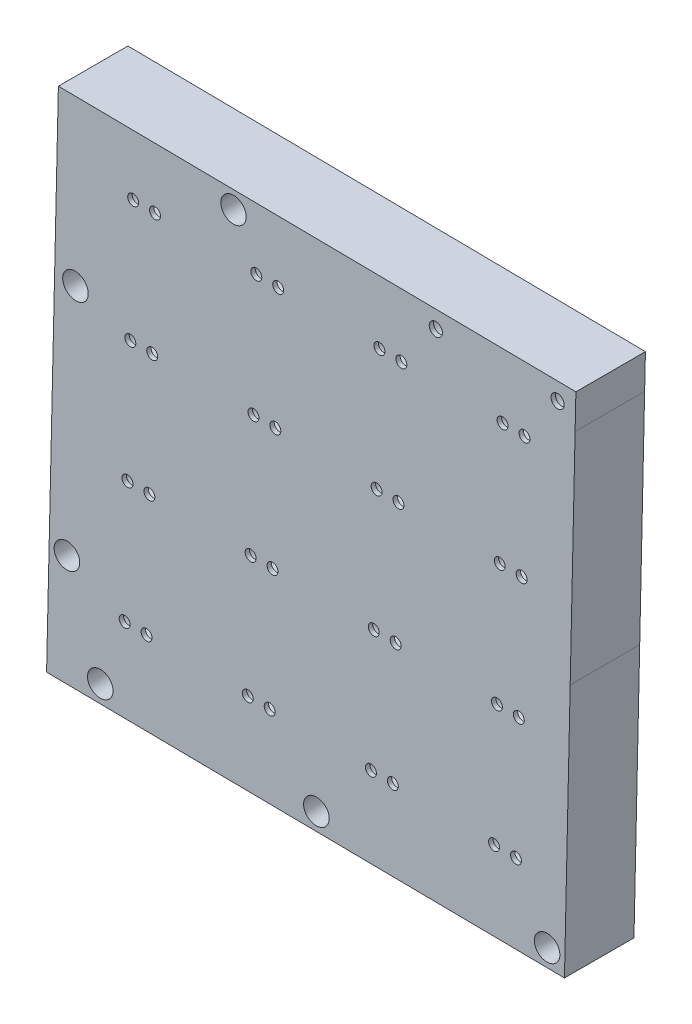
from build123d import *

# Parameters (mm, degrees)
SKETCH1_R           = 2
BOSS_EXTRUDE1_DEPTH = 1.5875
SKETCH5_R           = 5.08
SKETCH5_RX          = 4.682540056
SKETCH5_RY          = 4.572
SKETCH5_RX_2        = 4.738927588
SKETCH5_RX_3        = 4.634785374
BOSS_EXTRUDE2_DEPTH = 23.8125


with BuildPart() as part:
    # Sketch1 → Boss-Extrude1 (new body)
    with BuildSketch(Plane.XY):
        Polygon((99.117580399, -231.854490496), (99.409870771, -219.138709881), (-89.659246963, -216.965985044), (-93.970529946, -404.523749128), (95.228462617, -406.697966446), (97.319166692, -312.918338233), align=None)
        with BuildLine():
            add(Edge.make_bspline(
                [(-78.898400785, -399.474150819), (-77.064470838, -407.177802742), (-71.148575176, -401.699347247), (-65.232679515, -396.220891751), (-72.982505123, -393.995695323), (-80.732330731, -391.770498896), (-78.898400785, -399.474150819)],
                knots=[0, 0, 0, 2.094395102, 2.094395102, 4.188790205, 4.188790205, 6.283185307, 6.283185307, 6.283185307], degree=2, weights=[1, 0.5, 1, 0.5, 1, 0.5, 1]))
        make_face(mode=Mode.SUBTRACT)
        with BuildLine():
            add(Edge.make_bspline(
                [(-91.096699713, -364.99229495), (-89.262769767, -372.695946873), (-83.346874105, -367.217491377), (-77.430978443, -361.739035882), (-85.180804052, -359.513839454), (-92.93062966, -357.288643027), (-91.096699713, -364.99229495)],
                knots=[0, 0, 0, 2.094395102, 2.094395102, 4.188790205, 4.188790205, 6.283185307, 6.283185307, 6.283185307], degree=2, weights=[1, 0.5, 1, 0.5, 1, 0.5, 1]))
        make_face(mode=Mode.SUBTRACT)
        with Locations((-65.443590373, -374.262170426)):
            Circle(SKETCH1_R, mode=Mode.SUBTRACT)
        with Locations((-57.44570304, -374.446013285)):
            Circle(SKETCH1_R, mode=Mode.SUBTRACT)
        with Locations((-20.455474121, -375.296286508)):
            Circle(SKETCH1_R, mode=Mode.SUBTRACT)
        with Locations((-12.457586787, -375.480129366)):
            Circle(SKETCH1_R, mode=Mode.SUBTRACT)
        with Locations((-64.409474292, -329.274054174)):
            Circle(SKETCH1_R, mode=Mode.SUBTRACT)
        with Locations((-56.411586958, -329.457897033)):
            Circle(SKETCH1_R, mode=Mode.SUBTRACT)
        with Locations((-19.42135804, -330.308170255)):
            Circle(SKETCH1_R, mode=Mode.SUBTRACT)
        with Locations((-11.423470706, -330.492013114)):
            Circle(SKETCH1_R, mode=Mode.SUBTRACT)
        with BuildLine():
            add(Edge.make_bspline(
                [(0.051178563, -400.381415389), (1.885108509, -408.085067312), (7.801004171, -402.606611817), (13.716899833, -397.128156321), (5.967074225, -394.902959894), (-1.782751383, -392.677763466), (0.051178563, -400.381415389)],
                knots=[0, 0, 0, 2.094395102, 2.094395102, 4.188790205, 4.188790205, 6.283185307, 6.283185307, 6.283185307], degree=2, weights=[1, 0.5, 1, 0.5, 1, 0.5, 1]))
        make_face(mode=Mode.SUBTRACT)
        with Locations((24.532642131, -376.330402589)):
            Circle(SKETCH1_R, mode=Mode.SUBTRACT)
        with Locations((32.530529465, -376.514245448)):
            Circle(SKETCH1_R, mode=Mode.SUBTRACT)
        with BuildLine():
            add(Edge.make_bspline(
                [(84.325625913, -401.349871724), (86.159555859, -409.053523647), (92.075451521, -403.575068152), (97.991347183, -398.096612656), (90.241521575, -395.871416229), (82.491695967, -393.646219801), (84.325625913, -401.349871724)],
                knots=[0, 0, 0, 2.094395102, 2.094395102, 4.188790205, 4.188790205, 6.283185307, 6.283185307, 6.283185307], degree=2, weights=[1, 0.5, 1, 0.5, 1, 0.5, 1]))
        make_face(mode=Mode.SUBTRACT)
        with Locations((69.520758384, -377.36451867)):
            Circle(SKETCH1_R, mode=Mode.SUBTRACT)
        with Locations((77.518645717, -377.548361529)):
            Circle(SKETCH1_R, mode=Mode.SUBTRACT)
        with Locations((25.566758213, -331.342286337)):
            Circle(SKETCH1_R, mode=Mode.SUBTRACT)
        with Locations((33.564645546, -331.526129196)):
            Circle(SKETCH1_R, mode=Mode.SUBTRACT)
        with Locations((70.554874465, -332.376402418)):
            Circle(SKETCH1_R, mode=Mode.SUBTRACT)
        with Locations((78.552761799, -332.560245277)):
            Circle(SKETCH1_R, mode=Mode.SUBTRACT)
        with BuildLine():
            add(Edge.make_bspline(
                [(-87.072855874, -274.025140099), (-92.123024506, -280.12475884), (-84.122649609, -281.608206697), (-76.122274712, -283.091654554), (-79.072480977, -275.508587956), (-82.022687241, -267.925521358), (-87.072855874, -274.025140099)],
                knots=[0, 0, 0, 2.094395102, 2.094395102, 4.188790205, 4.188790205, 6.283185307, 6.283185307, 6.283185307], degree=2, weights=[1, 0.5, 1, 0.5, 1, 0.5, 1]))
        make_face(mode=Mode.SUBTRACT)
        with Locations((-63.375358211, -284.285937922)):
            Circle(SKETCH1_R, mode=Mode.SUBTRACT)
        with Locations((-55.377470877, -284.46978078)):
            Circle(SKETCH1_R, mode=Mode.SUBTRACT)
        with Locations((-18.387241958, -285.320054003)):
            Circle(SKETCH1_R, mode=Mode.SUBTRACT)
        with Locations((-10.389354624, -285.503896862)):
            Circle(SKETCH1_R, mode=Mode.SUBTRACT)
        with Locations((-62.341242129, -239.297821669)):
            Circle(SKETCH1_R, mode=Mode.SUBTRACT)
        with Locations((-54.343354795, -239.481664528)):
            Circle(SKETCH1_R, mode=Mode.SUBTRACT)
        with BuildLine():
            add(Edge.make_bspline(
                [(-30.075944864, -225.507102008), (-27.604931247, -233.030641315), (-22.235386192, -227.099523908), (-16.865841137, -221.1684065), (-24.706399809, -219.575984601), (-32.546958482, -217.983562701), (-30.075944864, -225.507102008)],
                knots=[0, 0, 0, 2.094395102, 2.094395102, 4.188790205, 4.188790205, 6.283185307, 6.283185307, 6.283185307], degree=2, weights=[1, 0.5, 1, 0.5, 1, 0.5, 1]))
        make_face(mode=Mode.SUBTRACT)
        with Locations((-17.353125877, -240.331937751)):
            Circle(SKETCH1_R, mode=Mode.SUBTRACT)
        with Locations((-9.355238543, -240.51578061)):
            Circle(SKETCH1_R, mode=Mode.SUBTRACT)
        with Locations((26.600874294, -286.354170084)):
            Circle(SKETCH1_R, mode=Mode.SUBTRACT)
        with Locations((34.598761628, -286.538012943)):
            Circle(SKETCH1_R, mode=Mode.SUBTRACT)
        with Locations((71.588990546, -287.388286166)):
            Circle(SKETCH1_R, mode=Mode.SUBTRACT)
        with Locations((79.58687788, -287.572129025)):
            Circle(SKETCH1_R, mode=Mode.SUBTRACT)
        with Locations((27.634990375, -241.366053832)):
            Circle(SKETCH1_R, mode=Mode.SUBTRACT)
        with Locations((35.632877709, -241.549896691)):
            Circle(SKETCH1_R, mode=Mode.SUBTRACT)
        with BuildLine():
            add(Edge.make_bspline(
                [(49.746771765, -226.803003688), (53.017264097, -224.200776392), (49.123023453, -222.662774438), (45.228782809, -221.124772483), (45.852531121, -225.265001734), (46.476279432, -229.405230985), (49.746771765, -226.803003688)],
                knots=[0, 0, 0, 2.094395102, 2.094395102, 4.188790205, 4.188790205, 6.283185307, 6.283185307, 6.283185307], degree=2, weights=[1, 0.5, 1, 0.5, 1, 0.5, 1]))
        make_face(mode=Mode.SUBTRACT)
        with Locations((72.623106628, -242.400169913)):
            Circle(SKETCH1_R, mode=Mode.SUBTRACT)
        with Locations((80.620993962, -242.584012772)):
            Circle(SKETCH1_R, mode=Mode.SUBTRACT)
        with BuildLine():
            add(Edge.make_bspline(
                [(94.236224562, -227.314262958), (97.506716894, -224.712035661), (93.61247625, -223.174033707), (89.718235606, -221.636031753), (90.341983918, -225.776261004), (90.965732229, -229.916490254), (94.236224562, -227.314262958)],
                knots=[0, 0, 0, 2.094395102, 2.094395102, 4.188790205, 4.188790205, 6.283185307, 6.283185307, 6.283185307], degree=2, weights=[1, 0.5, 1, 0.5, 1, 0.5, 1]))
        make_face(mode=Mode.SUBTRACT)
    extrude(amount=-BOSS_EXTRUDE1_DEPTH)

    # Sketch5 → Boss-Extrude2 (add)
    with BuildSketch(Plane(origin=(0, 0, -1.5875), x_dir=(-1, 0, 0), z_dir=(0, 0, -1))):
        Polygon((93.970529946, -404.523749128), (-95.228462617, -406.697966446), (-97.319166694, -312.918338164), (-99.117580399, -231.854490496), (-99.409870771, -219.138709881), (89.659246963, -216.965985044), align=None)
        with Locations((-92.730228243, -225.421519223)):
            Circle(SKETCH5_R, mode=Mode.SUBTRACT)
        with Locations((-48.240775446, -224.910259953)):
            Circle(SKETCH5_R, mode=Mode.SUBTRACT)
        with Locations(Location((-88.880866337, -400.265452035), (0, 0, -13.39057699))):
            Ellipse(SKETCH5_RX, SKETCH5_RY, mode=Mode.SUBTRACT)
        with Locations(Location((-4.606418986, -399.2969957), (0, 0, -13.39057699))):
            Ellipse(SKETCH5_RX, SKETCH5_RY, mode=Mode.SUBTRACT)
        with Locations(Location((74.343160361, -398.38973113), (0, 0, -13.39057699))):
            Ellipse(SKETCH5_RX, SKETCH5_RY, mode=Mode.SUBTRACT)
        with Locations(Location((86.54145929, -363.90787526), (0, 0, -13.39057699))):
            Ellipse(SKETCH5_RX, SKETCH5_RY, mode=Mode.SUBTRACT)
        with Locations(Location((83.422662153, -277.047311584), (0, 0, 39.62299733))):
            Ellipse(SKETCH5_RX_2, SKETCH5_RY, mode=Mode.SUBTRACT)
        with Locations(Location((25.672576955, -224.060870172), (0, 0, -18.182127676))):
            Ellipse(SKETCH5_RX_3, SKETCH5_RY, mode=Mode.SUBTRACT)
        with BuildLine():
            Line((65.535111524, -378.24370039), (57.53722419, -378.427543249))
            ThreePointArc((57.53722419, -378.427543249), (53.464173076, -374.537534436), (57.354181889, -370.464483322))
            Line((57.354181889, -370.464483322), (65.352069223, -370.280640463))
            ThreePointArc((65.352069223, -370.280640463), (69.425120337, -374.170649276), (65.535111524, -378.24370039))
        make_face(mode=Mode.SUBTRACT)
        with BuildLine():
            Line((20.546995272, -379.277816471), (12.549107938, -379.46165933))
            ThreePointArc((12.549107938, -379.46165933), (8.476056824, -375.571650517), (12.366065637, -371.498599403))
            Line((12.366065637, -371.498599403), (20.36395297, -371.314756544))
            ThreePointArc((20.36395297, -371.314756544), (24.437004084, -375.204765357), (20.546995272, -379.277816471))
        make_face(mode=Mode.SUBTRACT)
        with BuildLine():
            Line((-24.441120981, -380.311932552), (-32.439008314, -380.495775411))
            ThreePointArc((-32.439008314, -380.495775411), (-36.512059428, -376.605766599), (-32.622050616, -372.532715484))
            Line((-32.622050616, -372.532715484), (-24.624163282, -372.348872626))
            ThreePointArc((-24.624163282, -372.348872626), (-20.551112168, -376.238881438), (-24.441120981, -380.311932552))
        make_face(mode=Mode.SUBTRACT)
        with BuildLine():
            Line((-69.429237233, -381.346048634), (-77.427124567, -381.529891493))
            ThreePointArc((-77.427124567, -381.529891493), (-81.500175681, -377.63988268), (-77.610166868, -373.566831566))
            Line((-77.610166868, -373.566831566), (-69.612279534, -373.382988707))
            ThreePointArc((-69.612279534, -373.382988707), (-65.53922842, -377.27299752), (-69.429237233, -381.346048634))
        make_face(mode=Mode.SUBTRACT)
        with BuildLine():
            Line((64.501001485, -333.255847027), (56.503114152, -333.439689886))
            ThreePointArc((56.503114152, -333.439689886), (52.429794105, -329.549424226), (56.320059765, -325.476104179))
            Line((56.320059765, -325.476104179), (64.317947098, -325.29226132))
            ThreePointArc((64.317947098, -325.29226132), (68.391267145, -329.18252698), (64.501001485, -333.255847027))
        make_face(mode=Mode.SUBTRACT)
        with BuildLine():
            Line((19.512885233, -334.289963109), (11.514997899, -334.473805968))
            ThreePointArc((11.514997899, -334.473805968), (7.441677853, -330.583540308), (11.331943512, -326.510220261))
            Line((11.331943512, -326.510220261), (19.329830846, -326.326377402))
            ThreePointArc((19.329830846, -326.326377402), (23.403150893, -330.216643062), (19.512885233, -334.289963109))
        make_face(mode=Mode.SUBTRACT)
        with BuildLine():
            Line((-25.475237062, -335.3238163), (-33.473124396, -335.507659159))
            ThreePointArc((-33.473124396, -335.507659159), (-37.54617551, -331.617650346), (-33.656166697, -327.544599232))
            Line((-33.656166697, -327.544599232), (-25.658279363, -327.360756373))
            ThreePointArc((-25.658279363, -327.360756373), (-21.585228249, -331.250765186), (-25.475237062, -335.3238163))
        make_face(mode=Mode.SUBTRACT)
        with BuildLine():
            Line((-26.509347101, -290.335962938), (-34.507234434, -290.519805797))
            ThreePointArc((-34.507234434, -290.519805797), (-38.580554481, -286.629540137), (-34.690288821, -282.55622009))
            Line((-34.690288821, -282.55622009), (-26.692401488, -282.372377231))
            ThreePointArc((-26.692401488, -282.372377231), (-22.619081441, -286.262642891), (-26.509347101, -290.335962938))
        make_face(mode=Mode.SUBTRACT)
        with BuildLine():
            Line((18.478763109, -289.301583966), (10.480875775, -289.485426825))
            ThreePointArc((10.480875775, -289.485426825), (6.407824661, -285.595418013), (10.297833474, -281.522366898))
            Line((10.297833474, -281.522366898), (18.295720808, -281.33852404))
            ThreePointArc((18.295720808, -281.33852404), (22.368771922, -285.228532852), (18.478763109, -289.301583966))
        make_face(mode=Mode.SUBTRACT)
        with BuildLine():
            Line((-70.463353314, -336.357932382), (-78.461240648, -336.54177524))
            ThreePointArc((-78.461240648, -336.54177524), (-82.534291762, -332.651766428), (-78.644282949, -328.578715314))
            Line((-78.644282949, -328.578715314), (-70.646395616, -328.394872455))
            ThreePointArc((-70.646395616, -328.394872455), (-66.573344502, -332.284881267), (-70.463353314, -336.357932382))
        make_face(mode=Mode.SUBTRACT)
        with BuildLine():
            Line((-71.497469396, -291.369816129), (-79.49535673, -291.553658988))
            ThreePointArc((-79.49535673, -291.553658988), (-83.568407844, -287.663650175), (-79.678399031, -283.590599061))
            Line((-79.678399031, -283.590599061), (-71.680511697, -283.406756202))
            ThreePointArc((-71.680511697, -283.406756202), (-67.607460583, -287.296765015), (-71.497469396, -291.369816129))
        make_face(mode=Mode.SUBTRACT)
        with BuildLine():
            Line((-27.543469225, -245.347583796), (-35.541356559, -245.531426654))
            ThreePointArc((-35.541356559, -245.531426654), (-39.614407673, -241.641417842), (-35.72439886, -237.568366728))
            Line((-35.72439886, -237.568366728), (-27.726511526, -237.384523869))
            ThreePointArc((-27.726511526, -237.384523869), (-23.653460412, -241.274532681), (-27.543469225, -245.347583796))
        make_face(mode=Mode.SUBTRACT)
        with BuildLine():
            Line((-72.531585477, -246.381699877), (-80.529472811, -246.565542736))
            ThreePointArc((-80.529472811, -246.565542736), (-84.602523925, -242.675533923), (-80.712515112, -238.602482809))
            Line((-80.712515112, -238.602482809), (-72.714627778, -238.41863995))
            ThreePointArc((-72.714627778, -238.41863995), (-68.641576664, -242.308648763), (-72.531585477, -246.381699877))
        make_face(mode=Mode.SUBTRACT)
        with BuildLine():
            Line((17.444647027, -244.313467714), (9.446759694, -244.497310573))
            ThreePointArc((9.446759694, -244.497310573), (5.37370858, -240.60730176), (9.263717392, -236.534250646))
            Line((9.263717392, -236.534250646), (17.261604726, -236.350407787))
            ThreePointArc((17.261604726, -236.350407787), (21.33465584, -240.2404166), (17.444647027, -244.313467714))
        make_face(mode=Mode.SUBTRACT)
        with BuildLine():
            Line((62.432769323, -243.279614523), (54.434881989, -243.463457382))
            ThreePointArc((54.434881989, -243.463457382), (50.361561942, -239.573191722), (54.251827602, -235.499871675))
            Line((54.251827602, -235.499871675), (62.249714936, -235.316028816))
            ThreePointArc((62.249714936, -235.316028816), (66.323034982, -239.206294476), (62.432769323, -243.279614523))
        make_face(mode=Mode.SUBTRACT)
        with BuildLine():
            Line((63.395614571, -288.268468104), (55.308951021, -288.309599336))
            ThreePointArc((55.308951021, -288.309599336), (51.306164478, -284.347325514), (55.2684383, -280.344538972))
            Line((55.2684383, -280.344538972), (63.35510185, -280.30340774))
            ThreePointArc((63.35510185, -280.30340774), (67.357888393, -284.265681561), (63.395614571, -288.268468104))
        make_face(mode=Mode.SUBTRACT)
    extrude(amount=BOSS_EXTRUDE2_DEPTH)


solid = part.part
